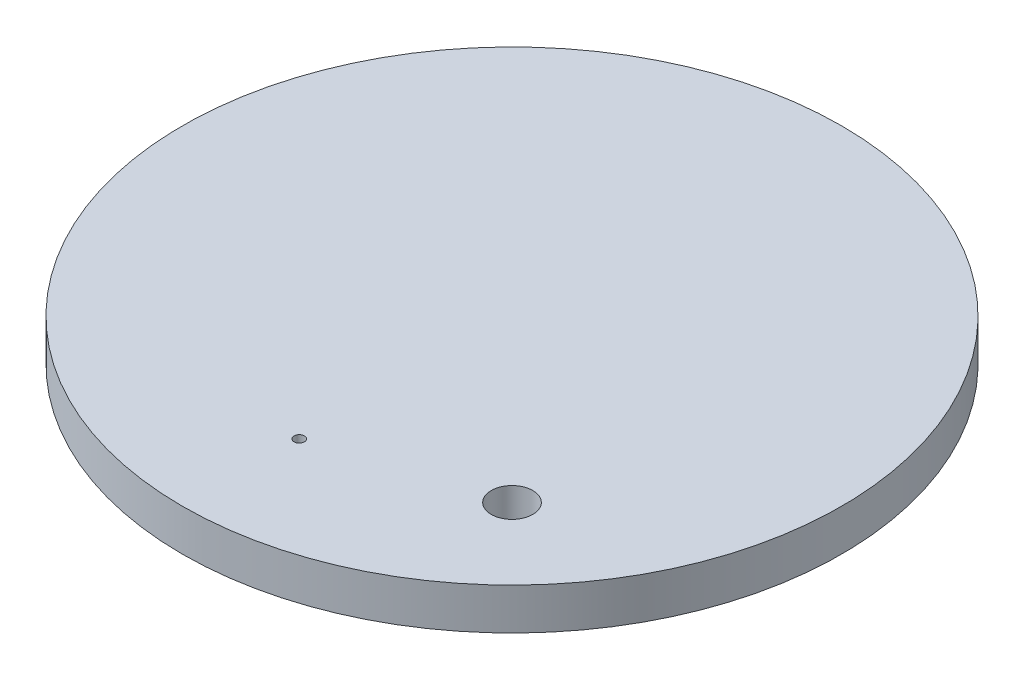
from build123d import *

# Parameters (mm, degrees)
SKETCH1_R               = 15.875
BOSS_EXTRUDE1_DEPTH     = 1
BOSS_EXTRUDE2_START     = 1
SKETCH2_R               = 15.875
SKETCH2_R_2             = 9.525
BOSS_EXTRUDE2_DEPTH     = 1
THREAD1_PITCH           = 0.25
CUT_EXTRUDE1_DEPTH      = 23.539548638
CUT_EXTRUDE1_DEPTH_BACK = 23.539548638
SKETCH3_R               = 0.25
CUT_EXTRUDE2_DEPTH      = 23.539548576
CUT_EXTRUDE2_DEPTH_BACK = 23.539548576
SKETCH4_R               = 1


with BuildPart() as part:
    # Sketch1 → Boss-Extrude1 (new body)
    with BuildSketch(Plane(origin=(0, 0, 0), x_dir=(1, 0, 0), z_dir=(0, 1, 0))):
        with Locations(Location((0, 0, 0), (0, 0, 270))):
            Circle(SKETCH1_R)
    extrude(amount=BOSS_EXTRUDE1_DEPTH)

    # Sketch2 → Boss-Extrude2 (add)
    with BuildSketch(Plane.XZ.offset(BOSS_EXTRUDE2_START)):
        with Locations(Location((0, 0, 0), (0, 0, 270))):
            Circle(SKETCH2_R)
        with Locations(Location((0, 0, 0), (0, 0, 270))):
            Circle(SKETCH2_R_2, mode=Mode.SUBTRACT)
    extrude(amount=-BOSS_EXTRUDE2_DEPTH)

    # Thread1: the profile of Thread Profile1 profile screwed along a right-hand helix of 4 turns, 6 arcs to a turn; built about Z, then put on its axis
    thread1_z = Axis((0, 0, 0), (0, 0, 1))
    thread1_corners = [(9.5247, 0, -0.000173205), (9.660316469, 0, 0.078125), (9.660316469, 0, 0.109375), (9.5247, 0, 0.187673204)]
    with BuildLine(mode=Mode.PRIVATE) as thread1_profile:
        Line(thread1_corners[0], thread1_corners[1])
        Line(thread1_corners[1], thread1_corners[2])
        Line(thread1_corners[2], thread1_corners[3])
        Line(thread1_corners[3], thread1_corners[0])
    thread1_cap = Face(thread1_profile.wire())
    thread1_turn_angles = [0, 30, 60, 90, 120, 150, 180, 210, 240, 270, 300, 330, 360]
    thread1_turn_weights = [1, 0.8660254037844387, 1, 0.8660254037844387, 1, 0.8660254037844387, 1, 0.8660254037844387, 1, 0.8660254037844387, 1, 0.8660254037844387, 1]
    thread1_turn_rails = [Edge.make_bspline([Vector(p[0], p[1], 0).rotate(thread1_z, thread1_turn_angles[k]) / thread1_turn_weights[k] + Vector(0, 0, p[2] + THREAD1_PITCH * thread1_turn_angles[k] / 360) for k in range(13)], [0, 0, 0, 1, 1, 2, 2, 3, 3, 4, 4, 5, 5, 6, 6, 6], 2, thread1_turn_weights) for p in thread1_corners]
    thread1_turn_sides = [Face.make_surface_from_curves(thread1_turn_rails[p[0]], thread1_turn_rails[p[1]]) for p in [(0, 1), (1, 2), (2, 3), (3, 0)]]
    thread1 = Plane(origin=(0, -1, 0), x_dir=(1, 0, 0), z_dir=(0, 1, 0)) * Solid(Shell([*[p.moved(Location((0, 0, THREAD1_PITCH * i))) for i in range(4) for p in thread1_turn_sides], thread1_cap, thread1_cap.rotate(thread1_z, 1440).moved(Location((0, 0, THREAD1_PITCH * 1440 / 360)))]))
    add(thread1, mode=Mode.SUBTRACT)

    # Sketch3 → Cut-Extrude1 (cut, two sides: drawn at the far end of the back side and taken through both)
    with BuildSketch(Plane(origin=(0, 1, 0), x_dir=(1, 0, 0), z_dir=(0, 1, 0)).offset(-CUT_EXTRUDE1_DEPTH_BACK)):
        with Locations(Location((0, -10.25, 0), (0, 0, 270))):
            Circle(SKETCH3_R)
    extrude(amount=CUT_EXTRUDE1_DEPTH + CUT_EXTRUDE1_DEPTH_BACK, mode=Mode.SUBTRACT)

    # Sketch4 → Cut-Extrude2 (cut, two sides: drawn at the far end of the back side and taken through both)
    with BuildSketch(Plane.XZ.offset(1).offset(-CUT_EXTRUDE2_DEPTH_BACK)):
        with Locations(Location((7.778174593, 7.778174593, 0), (0, 0, 270))):
            Circle(SKETCH4_R)
    extrude(amount=CUT_EXTRUDE2_DEPTH + CUT_EXTRUDE2_DEPTH_BACK, mode=Mode.SUBTRACT)


solid = part.part
